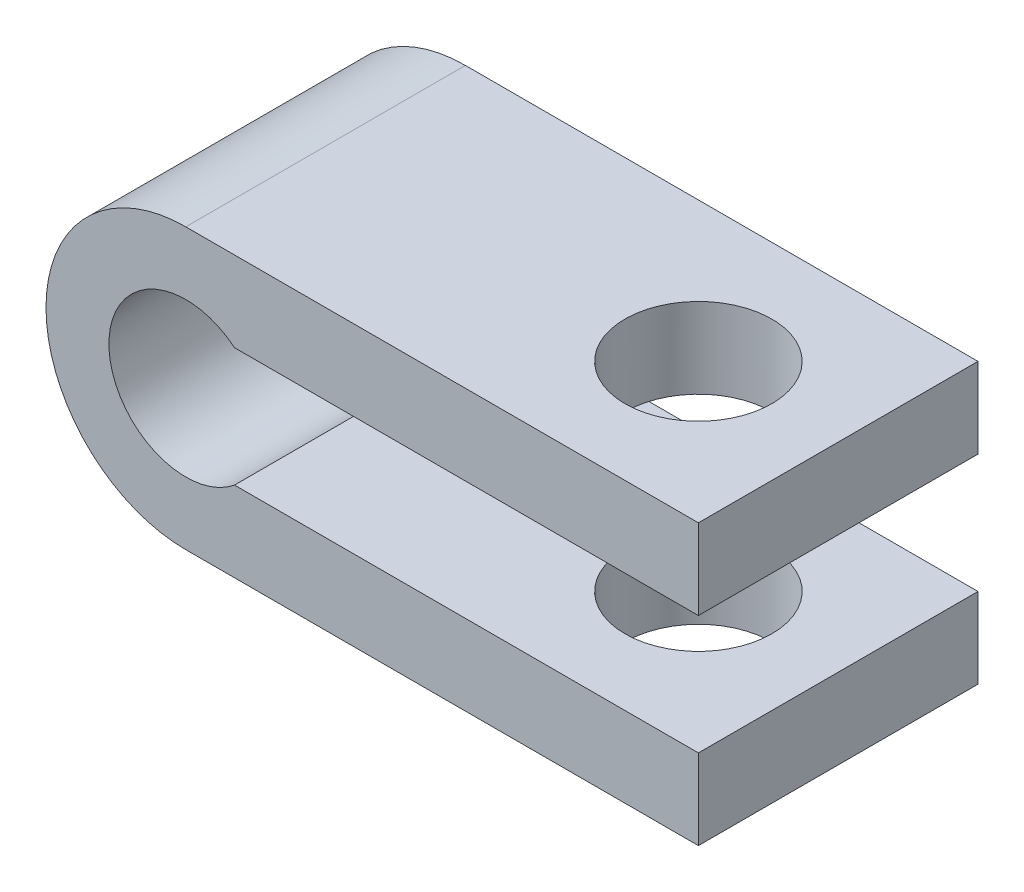
from build123d import *

# Parameters (mm, degrees)
BOSS_EXTRUDE1_DEPTH     = 12
CUT_EXTRUDE1_DEPTH      = 26.768197453
CUT_EXTRUDE1_DEPTH_BACK = 26.768197453
SKETCH2_R               = 3.15


with BuildPart() as part:
    # Sketch1 → Boss-Extrude1 (new body)
    with BuildSketch(Plane.XY):
        with BuildLine():
            Line((0, 6), (22, 6))
            Line((22, 6), (22, 2.552710574))
            Line((22, 2.552710574), (2.091331807, 2.552710574))
            ThreePointArc((2.091331807, 2.552710574), (-3.3, 0), (2.091331807, -2.552710574))
            Line((2.091331807, -2.552710574), (22, -2.552710574))
            Line((22, -2.552710574), (22, -6))
            Line((22, -6), (0, -6))
            ThreePointArc((0, -6), (-6, 0), (0, 6))
        make_face()
    extrude(amount=BOSS_EXTRUDE1_DEPTH)

    # Sketch2 → Cut-Extrude1 (cut, two sides: drawn at the far end of the back side and taken through both)
    with BuildSketch(Plane(origin=(0, 0, 0), x_dir=(1, 0, 0), z_dir=(0, 1, 0)).offset(-CUT_EXTRUDE1_DEPTH_BACK)):
        with Locations((16, -6)):
            Circle(SKETCH2_R)
    extrude(amount=CUT_EXTRUDE1_DEPTH + CUT_EXTRUDE1_DEPTH_BACK, mode=Mode.SUBTRACT)


solid = part.part
